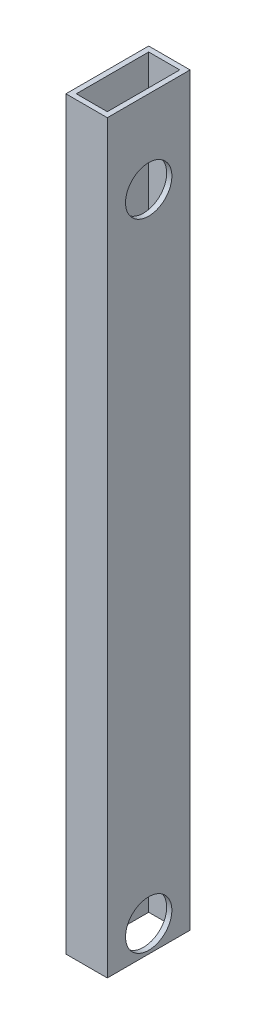
from build123d import *

# Parameters (mm, degrees)
SKETCH2_W           = 25.4
SKETCH2_H           = 50.8
SKETCH2_W_2         = 19.05
SKETCH2_H_2         = 44.45
EXTRUDE_THIN1_DEPTH = 457.2
SKETCH3_R           = 14.224
CUT_EXTRUDE1_DEPTH  = 461.714271539


with BuildPart() as part:
    # Sketch2 → Extrude-Thin1 (new body)
    with BuildSketch(Plane(origin=(0, 0, 0), x_dir=(1, 0, 0), z_dir=(0, 1, 0))):
        with Locations((12.7, 25.4)):
            Rectangle(SKETCH2_W, SKETCH2_H)
        with Locations((12.7, 25.4)):
            Rectangle(SKETCH2_W_2, SKETCH2_H_2, mode=Mode.SUBTRACT)
    extrude(amount=EXTRUDE_THIN1_DEPTH)

    # Sketch3 → Cut-Extrude1 (cut, through all)
    with BuildSketch(Plane(origin=(25.4, 0, 0), x_dir=(0, 0, -1), z_dir=(1, 0, 0))):
        with Locations((25.4, 16.256)):
            Circle(SKETCH3_R)
        with Locations((25.4, 406.4)):
            Circle(SKETCH3_R)
    extrude(amount=-CUT_EXTRUDE1_DEPTH, mode=Mode.SUBTRACT)


solid = part.part
